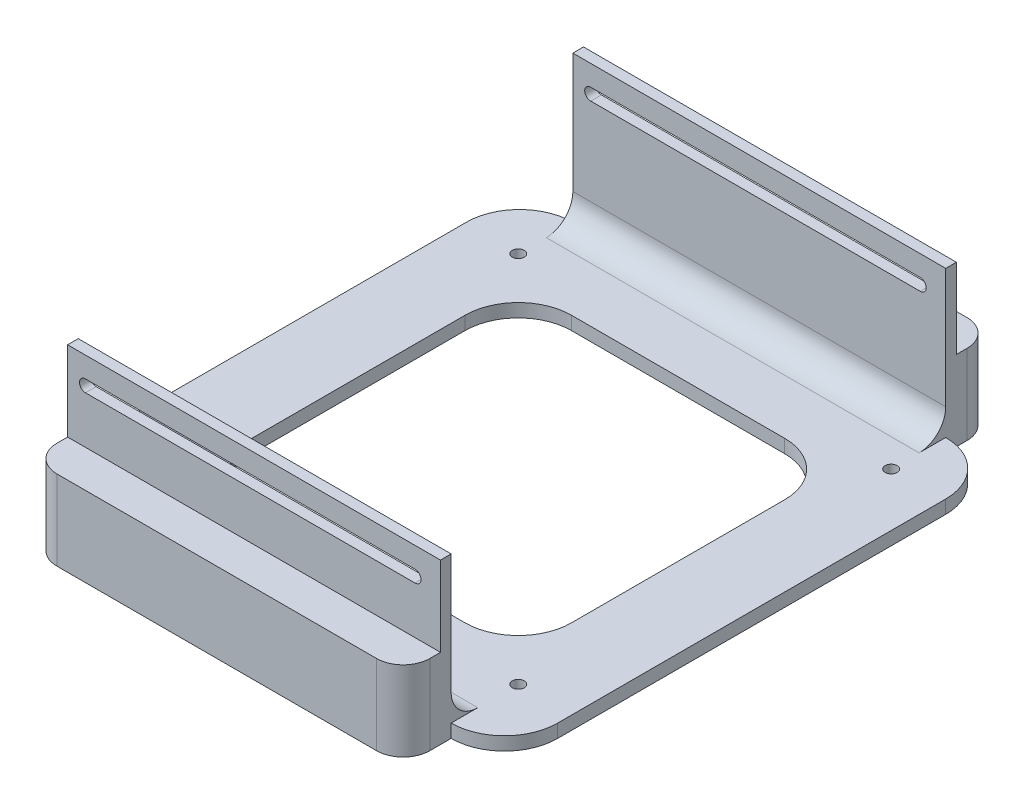
from build123d import *

# Parameters (mm, degrees)
SKETCH1_R           = 2.25
BOSS_EXTRUDE2_DEPTH = 5
BOSS_EXTRUDE3_DEPTH = 30
SKETCH4_W           = 140
SKETCH4_H           = 4
BOSS_EXTRUDE4_DEPTH = 30
CUT_EXTRUDE1_REACH  = 236.178
FILLET1_R           = 10


with BuildPart() as part:
    # Sketch1 → Boss-Extrude2 (new body)
    with BuildSketch(Plane(origin=(0, 0, 0), x_dir=(1, 0, 0), z_dir=(0, 1, 0))):
        with BuildLine():
            Line((-70, 90.5), (70, 90.5))
            ThreePointArc((70, 90.5), (84.142135624, 84.642135624), (90, 70.5))
            Line((90, 70.5), (90, -75.2))
            ThreePointArc((90, -75.2), (84.142135624, -89.342135624), (70, -95.2))
            Line((70, -95.2), (-70, -95.2))
            ThreePointArc((-70, -95.2), (-84.142135624, -89.342135624), (-90, -75.2))
            Line((-90, -75.2), (-90, 70.5))
            ThreePointArc((-90, 70.5), (-84.142135624, 84.642135624), (-70, 90.5))
        make_face()
        with Locations(Location((-70, 70, 0), (0, 0, 270))):
            Circle(SKETCH1_R, mode=Mode.SUBTRACT)
        with Locations(Location((70, 70, 0), (0, 0, 270))):
            Circle(SKETCH1_R, mode=Mode.SUBTRACT)
        with Locations(Location((-70, -70, 0), (0, 0, 270))):
            Circle(SKETCH1_R, mode=Mode.SUBTRACT)
        with Locations(Location((70, -70, 0), (0, 0, 270))):
            Circle(SKETCH1_R, mode=Mode.SUBTRACT)
        with BuildLine():
            Line((40, -60), (-40, -60))
            ThreePointArc((-40, -60), (-54.142135624, -54.142135624), (-60, -40))
            Line((-60, -40), (-60, 40))
            ThreePointArc((-60, 40), (-54.142135624, 54.142135624), (-40, 60))
            Line((-40, 60), (40, 60))
            ThreePointArc((40, 60), (54.142135624, 54.142135624), (60, 40))
            Line((60, 40), (60, -40))
            ThreePointArc((60, -40), (54.142135624, -54.142135624), (40, -60))
        make_face(mode=Mode.SUBTRACT)
    extrude(amount=BOSS_EXTRUDE2_DEPTH)

    # Sketch1<3> → Boss-Extrude3 (add)
    with BuildSketch(Plane(origin=(0, 0, 0), x_dir=(1, 0, 0), z_dir=(0, 1, 0))):
        with BuildLine():
            Line((-70, -95.2), (-70, -103.2))
            ThreePointArc((-70, -103.2), (-67.071067812, -110.271067812), (-60, -113.2))
            Line((-60, -113.2), (60, -113.2))
            ThreePointArc((60, -113.2), (67.071067812, -110.271067812), (70, -103.2))
            Line((70, -103.2), (70, -95.2))
            Line((70, -95.2), (-70, -95.2))
        make_face()
        with BuildLine():
            ThreePointArc((-70, 98.5), (-67.071067812, 105.571067812), (-60, 108.5))
            Line((-60, 108.5), (60, 108.5))
            ThreePointArc((60, 108.5), (67.071067812, 105.571067812), (70, 98.5))
            Line((70, 98.5), (70, 90.5))
            Line((70, 90.5), (-70, 90.5))
            Line((-70, 90.5), (-70, 98.5))
        make_face()
    extrude(amount=BOSS_EXTRUDE3_DEPTH)

    # Sketch4 → Boss-Extrude4 (add)
    with BuildSketch(Plane(origin=(0, 30, 0), x_dir=(1, 0, 0), z_dir=(0, 1, 0))):
        with Locations((0, 92.5)):
            Rectangle(SKETCH4_W, SKETCH4_H)
        with Locations((0, -97.2)):
            Rectangle(SKETCH4_W, SKETCH4_H)
    extrude(amount=BOSS_EXTRUDE4_DEPTH)

    # Cut-Extrude1: up to this face of the body (flat: up to its plane)
    cut_extrude1_end = Plane(part.part.faces().sort_by_distance((0, 45, -94.5))[0])
    # Sketch5 → Cut-Extrude1 (cut, up to the picked face)
    with BuildSketch(Plane.XY.offset(99.2), mode=Mode.PRIVATE) as cut_extrude1_sk1:
        with BuildLine():
            Line((-63.303955024, 52.25), (60.438343891, 52.25))
            ThreePointArc((60.438343891, 52.25), (62.688343891, 50), (60.438343891, 47.75))
            Line((60.438343891, 47.75), (-63.303955024, 47.75))
            ThreePointArc((-63.303955024, 47.75), (-65.553955024, 50), (-63.303955024, 52.25))
        make_face()
    cut_extrude1_tool1 = split(extrude(cut_extrude1_sk1.sketch, amount=-CUT_EXTRUDE1_REACH, mode=Mode.PRIVATE), bisect_by=cut_extrude1_end, keep=Keep.BOTH, mode=Mode.PRIVATE)
    add(cut_extrude1_tool1.solids().sort_by(Axis((-1.432806, 50, 99.2), (0, 0, -1)))[0], mode=Mode.SUBTRACT)

    # Fillet1
    # the kernel refuses this fillet: 10 mm, written as the material it adds along each edge
    with BuildSketch(Plane(origin=(70, 5, 95.2), x_dir=(0, 0, -1), z_dir=(-1, 0, 0)), Plane(origin=(-70, 5, -90.5), x_dir=(0, 0, 1), z_dir=(1, 0, 0))) as fillet1_piece_1:
        with BuildLine():
            CenterArc((FILLET1_R, -FILLET1_R), FILLET1_R, 90, 90)
            Line((0, -FILLET1_R), (0, 0))
            Line((0, 0), (FILLET1_R, 0))
        make_face()
    extrude(amount=140)


solid = part.part
